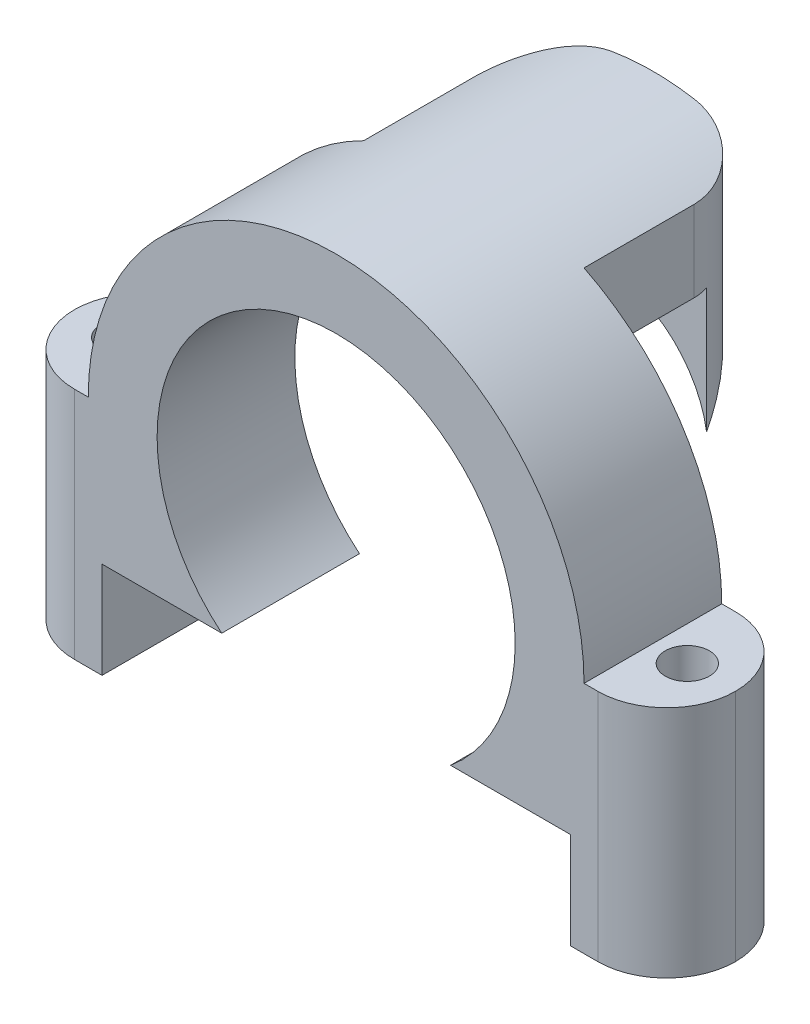
from build123d import *
from build123d.topology import SkipClean

# Parameters (mm, degrees)
SKETCH1_R             = 6
EXTRUDE1_DEPTH        = 10
SKETCH2_R             = 13
CUT_EXTRUDE1_DEPTH    = 6
SKETCH3_R             = 1.6
CUT_EXTRUDE2_DEPTH    = 10
SKETCH4_W             = 7
SKETCH4_H             = 10
SKETCH4_R             = 1.6
EXTRUDE3_DEPTH        = 7
FILLET2_R             = 5
SKETCH5_R             = 13
EXTRUDE4_DEPTH        = 4
EXTRUDE5_START        = 9
EXTRUDE5_DEPTH        = 9
EXTRUDE6_START        = 4
EXTRUDE6_DEPTH        = 4
FILLET3_R             = 5
M4_TAPPED_HOLE1_D     = 3.3
M4_TAPPED_HOLE1_DEPTH = 10.1
M4_TAPPED_HOLE1_TIP   = 0.991420021


# Some blends are built 0.0001 mm under size
with BuildPart() as part:
    # Sketch1 → Extrude1 (new body)
    with BuildSketch(Plane.XY):
        with BuildLine():
            Line((-18, 0), (-24, 0))
            Line((-24, 0), (-24, -10))
            Line((-24, -10), (24, -10))
            Line((24, -10), (24, 0))
            Line((24, 0), (18, 0))
            ThreePointArc((18, 0), (0, 18.000000653), (-18, 0))
        make_face()
        with Locations((0, 6.53e-07)):
            Circle(SKETCH1_R, mode=Mode.SUBTRACT)
    extrude(amount=EXTRUDE1_DEPTH)

    # Sketch2 → Cut-Extrude1 (cut)
    with BuildSketch(Plane(origin=(0, 0, 0), x_dir=(-1, 0, 0), z_dir=(0, 0, -1))):
        Circle(SKETCH2_R)
    extrude(amount=-CUT_EXTRUDE1_DEPTH, mode=Mode.SUBTRACT)

    # Sketch3 → Cut-Extrude2 (cut)
    with BuildSketch(Plane(origin=(0, 0, 0), x_dir=(-1, 0, 0), z_dir=(0, 1, 0))):
        with Locations(Location((-20.5, 5, 0), (0, 0, 90))):
            Circle(SKETCH3_R)
        with Locations(Location((20.5, 5, 0), (0, 0, 90))):
            Circle(SKETCH3_R)
    extrude(amount=-CUT_EXTRUDE2_DEPTH, mode=Mode.SUBTRACT)

    # Sketch4 → Extrude3 (add)
    # profile 1 of 2: a face of its own
    with SkipClean():  # the faces are left unmerged after this step: merging them gives an invalid solid
        with BuildSketch(Plane.XZ.offset(10)):
            with Locations((-20.5, 5)):
                Rectangle(SKETCH4_W, SKETCH4_H)
            with Locations((-20.5, 5)):
                Circle(SKETCH4_R, mode=Mode.SUBTRACT)
        # profile 2 of 2: a face of its own
        with BuildSketch(Plane.XZ.offset(10)):
            with Locations((20.5, 5)):
                Rectangle(SKETCH4_W, SKETCH4_H)
            with Locations((20.5, 5)):
                Circle(SKETCH4_R, mode=Mode.SUBTRACT)
        extrude(amount=EXTRUDE3_DEPTH)
    add(part.part.scale(1), mode=Mode.REPLACE)  # the faces are merged on a copy

    # Fillet2
    fillet2_edges = [part.edges().sort_by_distance(p)[0] for p in [
        (24, -8.5, 10),
        (24, -8.5, 0),
        (-24, -5, 10),
        (-24, -5, 0),
    ]]
    fillet(fillet2_edges, radius=FILLET2_R - 0.0001)  # a hair under: the kernel refuses the full size

    # Sketch5 → Extrude4 (cut)
    with BuildSketch(Plane(origin=(0, 0, 6), x_dir=(-1, 0, 0), z_dir=(0, 0, -1))):
        Circle(SKETCH5_R)
    extrude(amount=-EXTRUDE4_DEPTH, mode=Mode.SUBTRACT)

    # Sketch6 → Extrude5 (add)
    with BuildSketch(Plane(origin=(0, 0, 0), x_dir=(-1, 0, 0), z_dir=(0, 0, -1)).offset(EXTRUDE5_START)):
        with BuildLine():
            Line((-8, 10.246950766), (-8, 16.12451615))
            ThreePointArc((-8, 16.12451615), (0, 18.000000585), (8, 16.12451615))
            Line((8, 16.12451615), (8, 10.246950766))
            ThreePointArc((8, 10.246950766), (0, 13), (-8, 10.246950766))
        make_face()
    extrude(amount=-EXTRUDE5_DEPTH)

    # Sketch7 → Extrude6 (add)
    with BuildSketch(Plane(origin=(0, 0, -9), x_dir=(-1, 0, 0), z_dir=(0, 0, -1)).offset(EXTRUDE6_START)):
        with BuildLine():
            Line((8, 16.12451615), (8, 0))
            ThreePointArc((8, 0), (0, 8), (-8, 0))
            Line((-8, 0), (-8, 16.12451615))
            ThreePointArc((-8, 16.12451615), (0, 18.000000585), (8, 16.12451615))
        make_face()
    extrude(amount=-EXTRUDE6_DEPTH)

    # Fillet3
    # the kernel refuses this fillet: 5 mm, written as the material it takes off along each edge
    with BuildSketch(Plane(origin=(-8, 28.62451615, -13), x_dir=(0, 0, 1), z_dir=(0, -1, 0)), Plane(origin=(8, -12.5, -13), x_dir=(0, 0, 1), z_dir=(0, 1, 0))) as fillet3_piece_1:
        with BuildLine():
            CenterArc((FILLET3_R, -FILLET3_R), FILLET3_R, 90, 90)
            Line((0, -FILLET3_R), (0, 0))
            Line((0, 0), (FILLET3_R, 0))
        make_face()
    extrude(amount=41.12451615, mode=Mode.SUBTRACT)

    # M4 Tapped Hole1
    with Locations(Plane(origin=(-20.5, -17, 5), x_dir=(0, 0, -1), z_dir=(0, -1, 0))):
        with Locations((0, 0), (0, 41)):
            Hole(M4_TAPPED_HOLE1_D / 2, depth=M4_TAPPED_HOLE1_DEPTH)
            with Locations((0, 0, -(M4_TAPPED_HOLE1_DEPTH + M4_TAPPED_HOLE1_TIP / 2))):  # 118° drill point
                Cone(0, M4_TAPPED_HOLE1_D / 2, M4_TAPPED_HOLE1_TIP, mode=Mode.SUBTRACT)


solid = part.part
